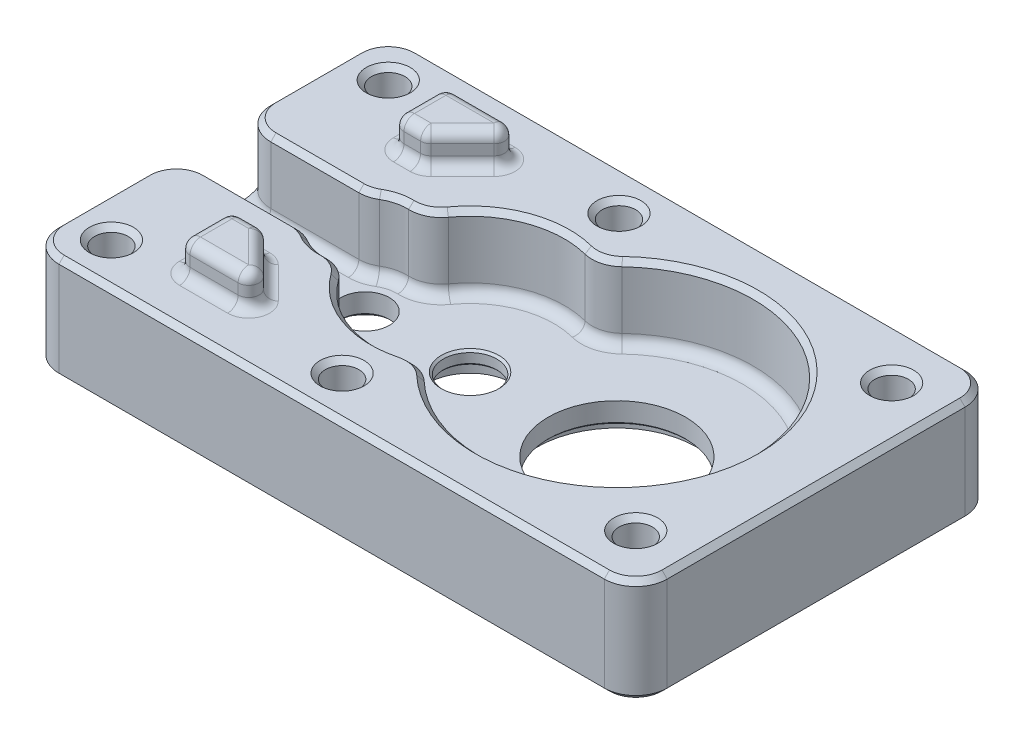
from build123d import *

# Parameters (mm, degrees)
BOSS_EXTRUDE1_DEPTH  = 3
SKETCH2_R            = 3.85
CUT_EXTRUDE1_DEPTH   = 1
SKETCH3_R            = 2.3
CUT_EXTRUDE2_DEPTH   = 47.35558218812488
BOSS_EXTRUDE2_DEPTH  = 7
CUT_EXTRUDE3_DEPTH   = 7
SKETCH6_R            = 4.099999999999999
CUT_EXTRUDE4_DEPTH   = 1.7
SKETCH7_R            = 2.5500000000000007
CUT_EXTRUDE5_DEPTH   = 48.05029224138783
SKETCH8_R            = 7.6000000000000005
CUT_EXTRUDE6_DEPTH   = 1
SKETCH9_R            = 6.550000000000002
CUT_EXTRUDE7_DEPTH   = 48.17880880225782
FILLET1_R            = 3
FILLET2_R            = 3
FILLET3_R            = 1
CHAMFER1_SIZE        = 0.2
SKETCH10_R           = 1.6000000000000019
CUT_EXTRUDE8_DEPTH   = 48.37974265485198
SKETCH11_R           = 1.5999999999999979
CUT_EXTRUDE9_DEPTH   = 48.37974265485198
SKETCH12_R           = 2.0999999999999974
CUT_EXTRUDE10_DEPTH  = 5
BOSS_EXTRUDE3_DEPTH  = 3
FILLET4_R            = 1
FILLET5_R            = 1
FILLET4_OF_MIRROR2_R = 1
FILLET5_OF_MIRROR2_R = 1
CHAMFER2_SIZE        = 0.5


with BuildPart() as part:
    # Sketch1 → Boss-Extrude1 (new body)
    with BuildSketch(Plane(origin=(0, 27.999999999999996, 0), x_dir=(1, 0, 0), z_dir=(0, 1, 0))):
        Polygon((43, -17.199999999999992), (-15, -17.2), (-15, 17.2), (43, 17.199999999999992), align=None)
    extrude(amount=BOSS_EXTRUDE1_DEPTH)

    # Sketch2 → Cut-Extrude1 (cut)
    with BuildSketch(Plane.XZ.offset(-27.999999999999996)):
        Circle(SKETCH2_R)
    extrude(amount=-CUT_EXTRUDE1_DEPTH, mode=Mode.SUBTRACT)

    # Sketch3 → Cut-Extrude2 (cut, through all)
    with BuildSketch(Plane.XZ.offset(-28.999999999999996)):
        Circle(SKETCH3_R)
    extrude(amount=-CUT_EXTRUDE2_DEPTH, mode=Mode.SUBTRACT)

    # Sketch4 → Boss-Extrude2 (add)
    with BuildSketch(Plane(origin=(0, 30.999999999999996, 0), x_dir=(1, 0, 0), z_dir=(0, 1, 0))):
        Polygon((-15, -17.2), (43, -17.199999999999992), (43, 17.199999999999992), (-15, 17.2), align=None)
        with BuildLine():
            ThreePointArc((1.7500000000000029, 3.596873642484539), (-4.000000000000001, 4.9e-16), (1.7500000000000029, -3.596873642484539))
            ThreePointArc((1.7500000000000029, -3.596873642484539), (6.8432344422697495, -8.428216372016559), (13.85714285714286, -8.131571126147259))
            ThreePointArc((13.85714285714286, -8.131571126147259), (37, 0), (13.85714285714286, 8.131571126147259))
            ThreePointArc((13.85714285714286, 8.131571126147259), (6.843234442269749, 8.42821637201656), (1.7500000000000029, 3.596873642484539))
        make_face(mode=Mode.SUBTRACT)
    extrude(amount=BOSS_EXTRUDE2_DEPTH)

    # Sketch5 → Cut-Extrude3 (cut)
    with BuildSketch(Plane(origin=(0, 38, 0), x_dir=(1, 0, 0), z_dir=(0, 1, 0))):
        Polygon((-2.6457513110645925, 2.9999999999999982), (-2.6457513110645925, -2.9999999999999982), (-15, -3), (-15, 3), align=None)
    extrude(amount=-CUT_EXTRUDE3_DEPTH, mode=Mode.SUBTRACT)

    # Sketch6 → Cut-Extrude4 (cut)
    with BuildSketch(Plane.XZ.offset(-27.999999999999996)):
        with Locations((10, 0)):
            Circle(SKETCH6_R)
    extrude(amount=-CUT_EXTRUDE4_DEPTH, mode=Mode.SUBTRACT)

    # Sketch7 → Cut-Extrude5 (cut, through all)
    with BuildSketch(Plane.XZ.offset(-29.699999999999996)):
        with Locations((10, 0)):
            Circle(SKETCH7_R)
    extrude(amount=-CUT_EXTRUDE5_DEPTH, mode=Mode.SUBTRACT)

    # Sketch8 → Cut-Extrude6 (cut)
    with BuildSketch(Plane.XZ.offset(-27.999999999999996)):
        with Locations((24, 0)):
            Circle(SKETCH8_R)
    extrude(amount=-CUT_EXTRUDE6_DEPTH, mode=Mode.SUBTRACT)

    # Sketch9 → Cut-Extrude7 (cut, through all)
    with BuildSketch(Plane.XZ.offset(-28.999999999999996)):
        with Locations((24, 0)):
            Circle(SKETCH9_R)
    extrude(amount=-CUT_EXTRUDE7_DEPTH, mode=Mode.SUBTRACT)

    # Fillet1
    fillet1_edges = [part.edges().sort_by_distance(p)[0] for p in [
        (-15, 33, 17.2),
        (43, 33, 17.199999999999992),
        (43, 33, -17.199999999999992),
        (-15, 33, -17.2),
    ]]
    fillet(fillet1_edges, radius=FILLET1_R)

    # Fillet2
    fillet2_edges = [part.edges().sort_by_distance(p)[0] for p in [
        (13.85714285714286, 34.5, 8.13157112614726),
        (1.750000000000003, 34.5, 3.5968736424845384),
        (-2.6457513110645925, 34.5, 2.9999999999999982),
        (-2.6457513110645925, 34.5, -2.9999999999999982),
        (13.857142857142863, 34.5, -8.131571126147264),
        (1.750000000000003, 34.5, -3.596873642484539),
        (-15, 34.5, 3),
        (-15, 34.5, -3),
    ]]
    fillet(fillet2_edges, radius=FILLET2_R)

    # Fillet3
    fillet3_edges = [part.edges().sort_by_distance(p)[0] for p in [
        (-14.121320343559642, 31, 3.878679656440358),
        (-7.802775637731996, 31, 2.999999999999999),
        (-2.8037675497267185, 31, 3.1091276650217043),
        (-1.0000331784075014, 30.999999999999996, 3.8729747794278486),
        (1.57203171563431, 31, 4.302537419625892),
        (6.931902414879216, 30.999999999999996, 8.460896950570664),
        (13.75000000000006, 31, 8.714212528966701),
        (37, 30.999999999999996, 5.33e-15),
        (13.749999999999947, 31, -8.714212528966673),
        (6.9319024148792145, 30.999999999999996, -8.460896950570664),
        (1.5720317156342107, 31, -4.302537419625842),
        (-1.0000331784075025, 30.999999999999996, -3.8729747794278486),
        (-2.803767549726719, 31, -3.1091276650217043),
        (-14.121320343559642, 31, -3.8786796564403576),
        (-7.802775637731997, 31, -2.999999999999999),
    ]]
    fillet(fillet3_edges, radius=FILLET3_R)

    # Chamfer1
    chamfer1_edges = [part.edges().sort_by_distance(p)[0] for p in [
        (7.449999999999999, 31, 3.1e-16),
        (7.449999999999999, 29.699999999999996, 3.1e-16),
        (-2.3, 28.999999999999996, 2.8e-16),
        (17.45, 28.999999999999996, 8e-16),
    ]]
    chamfer(chamfer1_edges, length=CHAMFER1_SIZE)

    # Sketch10 → Cut-Extrude8 (cut, through all)
    with BuildSketch(Plane.XZ.offset(-27.999999999999996)):
        with Locations((-11.000000000000004, -13.200000000000005)):
            Circle(SKETCH10_R)
        with Locations((10.999999999999996, -13.200000000000008)):
            Circle(SKETCH10_R)
        with Locations((-11.000000000000004, 13.199999999999994)):
            Circle(SKETCH10_R)
        with Locations((10.999999999999996, 13.199999999999994)):
            Circle(SKETCH10_R)
    extrude(amount=-CUT_EXTRUDE8_DEPTH, mode=Mode.SUBTRACT)

    # Sketch11 → Cut-Extrude9 (cut, through all)
    with BuildSketch(Plane.XZ.offset(-27.999999999999996)):
        with Locations((38.00000000000001, -12.199999999999992)):
            Circle(SKETCH11_R)
    cut_extrude9 = extrude(amount=-CUT_EXTRUDE9_DEPTH, mode=Mode.SUBTRACT)

    # Sketch12 → Cut-Extrude10 (cut)
    with BuildSketch(Plane.XZ.offset(-27.999999999999996)):
        with Locations((38.00000000000001, -12.199999999999992)):
            Circle(SKETCH12_R)
    cut_extrude10 = extrude(amount=-CUT_EXTRUDE10_DEPTH, mode=Mode.SUBTRACT)

    # Mirror1: Cut-Extrude9, Cut-Extrude10 across plane
    add(cut_extrude9.mirror(Plane.XY), mode=Mode.SUBTRACT)
    add(cut_extrude10.mirror(Plane.XY), mode=Mode.SUBTRACT)

    # Sketch13 → Boss-Extrude3 (add)
    with BuildSketch(Plane(origin=(0, 38, 0), x_dir=(1, 0, 0), z_dir=(0, 1, 0))):
        Polygon((3.000000000000001, -12.7), (-4.999999999999999, -12.700000000000001), (-4.999999999999999, -7.700000000000001), (-2.0000000000000533, -7.700000000000001), align=None)
    boss_extrude3 = extrude(amount=BOSS_EXTRUDE3_DEPTH)

    # Fillet4
    fillet4_edges = [part.edges().sort_by_distance(p)[0] for p in [
        (-0.9999999999999991, 41, 12.7),
        (-4.999999999999999, 41, 10.200000000000001),
        (-3.500000000000026, 41, 7.700000000000001),
        (0.4999999999999738, 41, 10.2),
        (-2.0000000000000533, 39.5, 7.700000000000001),
        (-4.999999999999999, 39.5, 7.700000000000001),
        (-4.999999999999999, 39.5, 12.700000000000001),
        (3.000000000000001, 39.5, 12.7),
    ]]
    fillet(fillet4_edges, radius=FILLET4_R)

    # Fillet5
    fillet5_edges = [part.edges().sort_by_distance(p)[0] for p in [
        (-4.707106781186547, 38, 12.407106781186549),
        (-4.999999999999999, 38, 10.200000000000001),
        (-4.707106781186546, 38, 7.992893218813453),
        (-3.207106781186571, 38, 7.700000000000001),
        (-2.031530130008058, 38, 7.776120467488713),
        (-0.20710678118658454, 38, 9.49289321881345),
        (1.5096659701381776, 38, 12.082683432365087),
        (-1.7071067811865541, 38, 12.700000000000001),
    ]]
    fillet(fillet5_edges, radius=FILLET5_R)

    # Mirror2: Boss-Extrude3 across plane
    add(boss_extrude3.mirror(Plane.XY))

    # Fillet4 of Mirror2
    fillet4_of_mirror2_edges = [part.edges().sort_by_distance(p)[0] for p in [
        (-0.9999999999999991, 41, -12.7),
        (-4.999999999999999, 41, -10.200000000000001),
        (-3.500000000000026, 41, -7.700000000000001),
        (0.4999999999999738, 41, -10.2),
        (-2.0000000000000533, 39.5, -7.700000000000001),
        (-4.999999999999999, 39.5, -7.700000000000001),
        (-4.999999999999999, 39.5, -12.700000000000001),
        (3.000000000000001, 39.5, -12.7),
    ]]
    fillet(fillet4_of_mirror2_edges, radius=FILLET4_OF_MIRROR2_R)

    # Fillet5 of Mirror2
    fillet5_of_mirror2_edges = [part.edges().sort_by_distance(p)[0] for p in [
        (-4.707106781186547, 38, -12.407106781186549),
        (-4.999999999999999, 38, -10.200000000000001),
        (-4.707106781186546, 38, -7.992893218813453),
        (-3.207106781186571, 38, -7.700000000000001),
        (-2.031530130008058, 38, -7.776120467488713),
        (-0.20710678118658454, 38, -9.49289321881345),
        (1.5096659701381776, 38, -12.082683432365087),
        (-1.7071067811865541, 38, -12.700000000000001),
    ]]
    fillet(fillet5_of_mirror2_edges, radius=FILLET5_OF_MIRROR2_R)

    # Chamfer2
    chamfer2_edges = [part.edges().sort_by_distance(p)[0] for p in [
        (35.90000000000001, 27.999999999999996, 12.199999999999992),
        (35.90000000000001, 27.999999999999996, -12.199999999999992),
        (-12.600000000000005, 27.999999999999996, 13.199999999999994),
        (9.399999999999995, 27.999999999999996, 13.199999999999994),
        (9.399999999999995, 27.999999999999996, -13.200000000000008),
        (-12.600000000000005, 27.999999999999996, -13.200000000000005),
        (14, 27.999999999999996, 17.199999999999996),
        (42.121320343559645, 27.999999999999996, 16.321320343559634),
        (-14.121320343559642, 27.999999999999996, 16.32132034355964),
        (43, 27.999999999999996, 0),
        (-15, 27.999999999999996, 0),
        (42.121320343559645, 27.999999999999996, -16.321320343559634),
        (-14.121320343559642, 27.999999999999996, -16.32132034355964),
        (14, 27.999999999999996, -17.199999999999996),
        (-12.600000000000005, 38, 13.199999999999994),
        (9.399999999999995, 38, 13.199999999999994),
        (36.400000000000006, 38, 12.199999999999994),
        (36.400000000000006, 38, -12.19999999999999),
        (9.399999999999995, 38, -13.200000000000008),
        (-12.600000000000005, 38, -13.200000000000005),
        (-7.802775637731996, 38, 2.999999999999999),
        (-2.8037675497267185, 38, 3.1091276650217043),
        (-14.121320343559642, 38, 3.878679656440358),
        (-1.0000331784075014, 38, 3.8729747794278486),
        (-15, 38, 10.099999999999998),
        (1.5720317156343104, 38, 4.302537419625892),
        (-14.121320343559642, 38, 16.32132034355964),
        (6.931902414879216, 38, 8.460896950570662),
        (14, 38, 17.199999999999996),
        (13.750000000000053, 38, 8.714212528966698),
        (42.121320343559645, 38, 16.321320343559634),
        (37, 38, 0),
        (43, 38, 0),
        (13.749999999999948, 38, -8.714212528966673),
        (42.121320343559645, 38, -16.321320343559634),
        (6.931902414879216, 38, -8.460896950570667),
        (14, 38, -17.199999999999996),
        (1.5720317156342112, 38, -4.302537419625842),
        (-14.121320343559642, 38, -16.32132034355964),
        (-1.0000331784075025, 38, -3.8729747794278486),
        (-15, 38, -10.1),
        (-2.803767549726719, 38, -3.1091276650217043),
        (-14.121320343559642, 38, -3.8786796564403576),
        (-7.802775637731997, 38, -2.999999999999999),
    ]]
    chamfer(chamfer2_edges, length=CHAMFER2_SIZE)


solid = part.part
